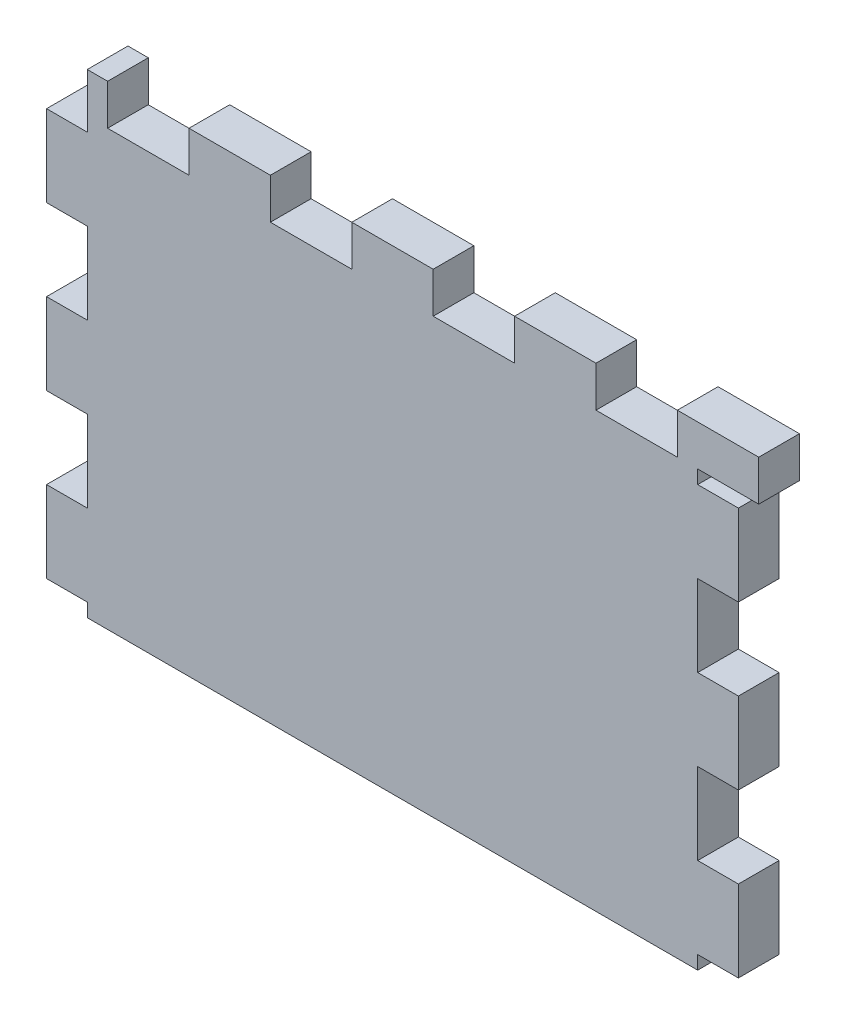
from build123d import *

# Parameters (mm, degrees)
SKETCH1_W               = 45
SKETCH1_H               = 32
BOSS_EXTRUDE1_DEPTH     = 3
SKETCH2_W               = 3
SKETCH2_H               = 6
BOSS_EXTRUDE2_DEPTH     = 3
LPATTERN1_COUNT         = 2
LPATTERN1_PITCH         = 12
LPATTERN1_COL_COUNT     = 2
LPATTERN1_COL_PITCH     = 12
SKETCH3_W               = 6
SKETCH3_H               = 3
BOSS_EXTRUDE3_DEPTH     = 3
LPATTERN2_COUNT         = 3
LPATTERN2_PITCH         = 12
LPATTERN2_COL_COUNT     = 3
LPATTERN2_COL_PITCH     = 12
MIRROR1_COPY_1_SKETCH_W = 3
MIRROR1_COPY_1_SKETCH_H = 6
MIRROR1_COPY_1_DEPTH    = 3
MIRROR1_COPY_2_SKETCH_W = 3
MIRROR1_COPY_2_SKETCH_H = 6
MIRROR1_COPY_2_DEPTH    = 3
MIRROR1_COPY_3_SKETCH_W = 3
MIRROR1_COPY_3_SKETCH_H = 6
MIRROR1_COPY_3_DEPTH    = 3
SKETCH5_W               = 4.5
SKETCH5_H               = 3
CUT_EXTRUDE1_DEPTH      = 3


with BuildPart() as part:
    # Sketch1 → Boss-Extrude1 (new body)
    with BuildSketch(Plane.XY):
        Rectangle(SKETCH1_W, SKETCH1_H)
    extrude(amount=BOSS_EXTRUDE1_DEPTH)

    # Sketch2 → Boss-Extrude2 (add)
    with BuildSketch(Plane.ZY.offset(22.5)):
        with Locations((1.5, 0)):
            Rectangle(SKETCH2_W, SKETCH2_H)
    boss_extrude2 = extrude(amount=BOSS_EXTRUDE2_DEPTH)

    # LPattern1: Boss-Extrude2 ×2
    with Locations(*[(0, -i * LPATTERN1_PITCH, 0) for i in range(1, LPATTERN1_COUNT)]):
        add(boss_extrude2)

    # LPattern1 col: Boss-Extrude2 ×2
    with Locations(*[(0, i * LPATTERN1_COL_PITCH, 0) for i in range(1, LPATTERN1_COL_COUNT)]):
        add(boss_extrude2)

    # Sketch3 → Boss-Extrude3 (add)
    with BuildSketch(Plane(origin=(0, 16, 0), x_dir=(1, 0, 0), z_dir=(0, 1, 0))):
        with Locations((0, -1.5)):
            Rectangle(SKETCH3_W, SKETCH3_H)
    boss_extrude3 = extrude(amount=BOSS_EXTRUDE3_DEPTH)

    # LPattern2: Boss-Extrude3 ×3
    with Locations(*[(-i * LPATTERN2_PITCH, 0, 0) for i in range(1, LPATTERN2_COUNT)]):
        add(boss_extrude3)

    # LPattern2 col: Boss-Extrude3 ×3
    with Locations(*[(i * LPATTERN2_COL_PITCH, 0, 0) for i in range(1, LPATTERN2_COL_COUNT)]):
        add(boss_extrude3)

    # Mirror1 copy 1 sketch → Mirror1 copy 1 (add)
    with BuildSketch(Plane(origin=(22.5, -12, 0), x_dir=(0, 0, 1), z_dir=(1, 0, 0))):
        with Locations((1.5, 0)):
            Rectangle(MIRROR1_COPY_1_SKETCH_W, MIRROR1_COPY_1_SKETCH_H)
    extrude(amount=MIRROR1_COPY_1_DEPTH)

    # Mirror1 copy 2 sketch → Mirror1 copy 2 (add)
    with BuildSketch(Plane(origin=(22.5, 12, 0), x_dir=(0, 0, 1), z_dir=(1, 0, 0))):
        with Locations((1.5, 0)):
            Rectangle(MIRROR1_COPY_2_SKETCH_W, MIRROR1_COPY_2_SKETCH_H)
    extrude(amount=MIRROR1_COPY_2_DEPTH)

    # Mirror1 copy 3 sketch → Mirror1 copy 3 (add)
    with BuildSketch(Plane(origin=(22.5, 0, 0), x_dir=(0, 0, 1), z_dir=(1, 0, 0))):
        with Locations((1.5, 0)):
            Rectangle(MIRROR1_COPY_3_SKETCH_W, MIRROR1_COPY_3_SKETCH_H)
    extrude(amount=MIRROR1_COPY_3_DEPTH)

    # Sketch5 → Cut-Extrude1 (cut)
    with BuildSketch(Plane(origin=(0, 0, 0), x_dir=(-1, 0, 0), z_dir=(0, 0, -1))):
        with Locations((24.75, 17.5)):
            Rectangle(SKETCH5_W, SKETCH5_H)
    extrude(amount=-CUT_EXTRUDE1_DEPTH, mode=Mode.SUBTRACT)


solid = part.part
